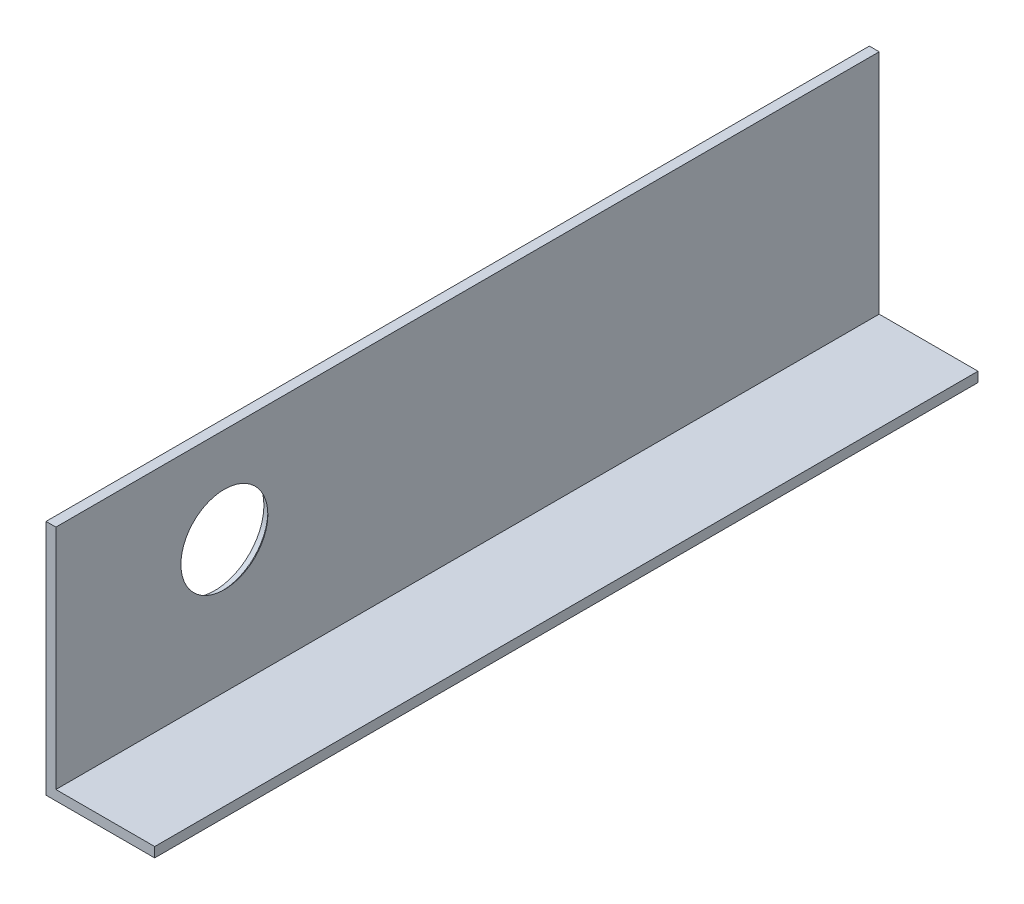
from build123d import *

# Parameters (mm, degrees)
BOSS_EXTRUDE1_DEPTH = 250


# Read off the part's stored shape, not the designer's step: Cavity1
with BuildPart() as part:
    # Sketch1 → Boss-Extrude1 (new body)
    with BuildSketch(Plane.XY):
        Polygon((0, 72), (3, 72), (3, 3), (33, 3), (33, 0), (0, 0), align=None)
    extrude(amount=BOSS_EXTRUDE1_DEPTH)

    # Cavity1 outline → Cavity1 (revolve, cut)
    with BuildSketch(Plane(origin=(0, 43.176202168, 198.837075549), x_dir=(0, 1, 0), z_dir=(0, 0, -1))):
        with BuildLine():
            Line((15, 0), (15, 2.2))
            Line((15, 2.2), (14, 2.2))
            ThreePointArc((14, 2.2), (13.765685425, 2.765685425), (13.2, 3))
            Line((13.2, 3), (0, 3))
            Line((0, 3), (0, 0))
            Line((0, 0), (15, 0))
        make_face()
    revolve(axis=Axis((0, 43.176202168, 198.837075549), (1, 0, 0)), mode=Mode.SUBTRACT)


solid = part.part
